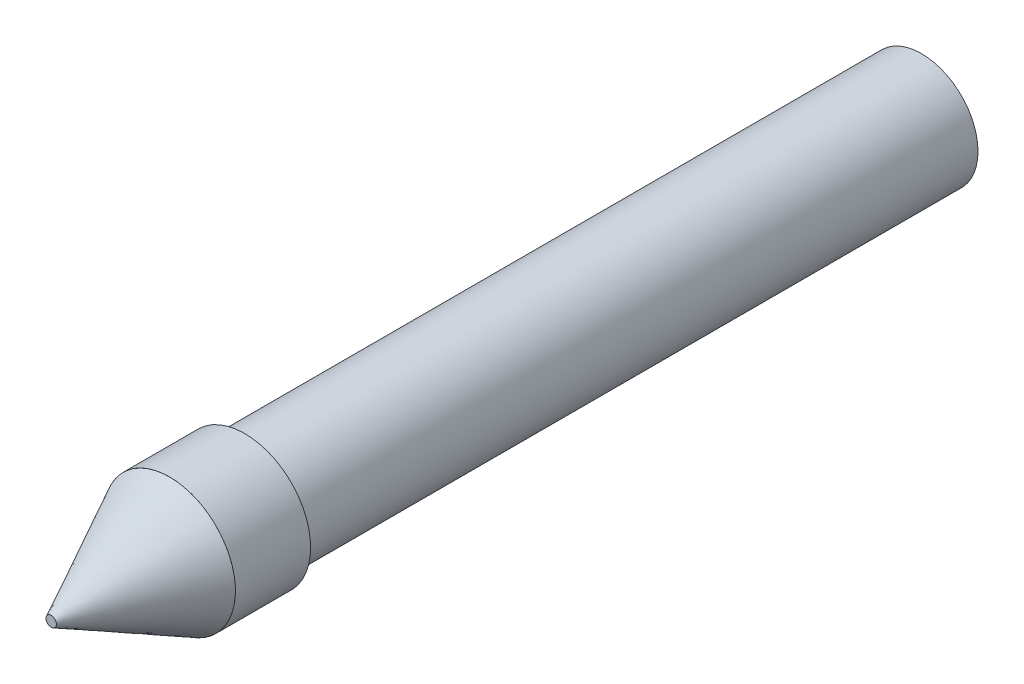
from build123d import *

# Parameters (mm, degrees)
SKETCH1_R           = 19.05
SKETCH1_R_2         = 15.875
BOSS_EXTRUDE1_DEPTH = 254
SKETCH2_R           = 22.225
SKETCH2_R_2         = 19.05
BOSS_EXTRUDE2_DEPTH = 25.4


with BuildPart() as part:
    # Sketch1 → Boss-Extrude1 (new body)
    with BuildSketch(Plane.XY):
        Circle(SKETCH1_R)
        Circle(SKETCH1_R_2, mode=Mode.SUBTRACT)
    extrude(amount=BOSS_EXTRUDE1_DEPTH)


with BuildPart() as body_2:
    # Sketch2 → Boss-Extrude2 (new body)
    with BuildSketch(Plane.XY.offset(254)):
        Circle(SKETCH2_R)
        Circle(SKETCH2_R_2, mode=Mode.SUBTRACT)
    extrude(amount=-BOSS_EXTRUDE2_DEPTH)


with BuildPart() as body_3:
    # Loft1: read off the stored shape, not the designer's step
    # Loft1: loft between two sections, ruled curve by curve
    loft1_from = [
        Edge.make_bspline([(-1.607377802, 0.691980204, 294), (-0.223417394, 3.906735807, 294), (2.99133821, 2.522775399, 294), (1.607377802, -0.691980204, 294), (0.223417394, -3.906735807, 294), (-2.99133821, -2.522775399, 294), (-1.607377802, 0.691980204, 294)], [0, 0, 0, 0, 0.5, 0.5, 0.5, 1, 1, 1, 1], 3, [1, 0.333333333, 0.333333333, 1, 0.333333333, 0.333333333, 1]),
    ]
    loft1_to = [
        Edge.make_bspline([(-22.073398658, 2.591466124, 254), (-16.890466409, 46.738263441, 254), (27.256330907, 41.555331192, 254), (22.073398658, -2.591466124, 254), (16.890466409, -46.738263441, 254), (-27.256330907, -41.555331192, 254), (-22.073398658, 2.591466124, 254)], [0, 0, 0, 0, 0.5, 0.5, 0.5, 1, 1, 1, 1], 3, [1, 0.333333333, 0.333333333, 1, 0.333333333, 0.333333333, 1]),
    ]
    loft1 = Solid(Shell([*[Face.make_surface_from_curves(loft1_from[k], loft1_to[k]) for k in range(1)], Face(Wire(loft1_from)), Face(Wire(loft1_to))]))
    add(loft1)


solid = Compound([part.part, body_2.part, body_3.part])
